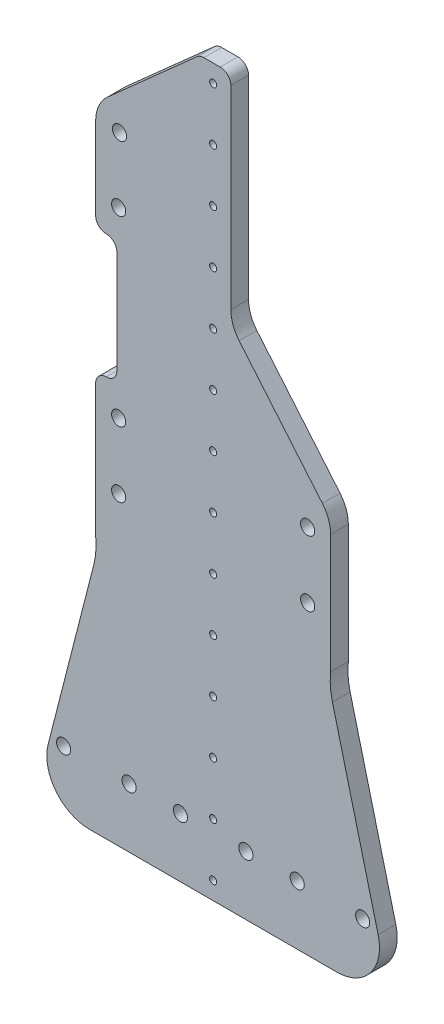
from build123d import *

# Parameters (mm, degrees)
SKETCH_1_R             = 2
EXTRUDE_1_DEPTH        = 5
SKETCH_2_R             = 1
CUT_EXTRUDE_1_DEPTH    = 20
PATTERN_LINEAR_1_COUNT = 14
PATTERN_LINEAR_1_PITCH = 15
FILLET_1_R             = 10
SKETCH_3_W             = 6
SKETCH_3_H             = 35
CUT_EXTRUDE_2_DEPTH    = 13
FILLET_2_R             = 3


with BuildPart() as part:
    # 草图1 → 凸台-拉伸1 (new body)
    # profile 1 of 4: a face of its own
    with BuildSketch(Plane.XY):
        with BuildLine():
            ThreePointArc((-33.2, -29.85450543), (-33.123455397, -33.472929676), (-33.700274419, -37.045902236))
            Line((-33.700274419, -37.045902236), (-46.624977248, -87.523440915))
            ThreePointArc((-46.624977248, -87.523440915), (-44.479417414, -97.858032719), (-35, -102.5))
            Line((-35, -102.5), (-5, -102.5))
            Line((-5, -102.5), (5, -102.5))
            Line((5, -102.5), (35, -102.5))
            ThreePointArc((35, -102.5), (44.479417414, -97.858032719), (46.624977248, -87.523440915))
            Line((46.624977248, -87.523440915), (33.700274419, -37.045902236))
            ThreePointArc((33.700274419, -37.045902236), (33.123455397, -33.472929676), (33.2, -29.85450543))
            Line((33.2, -29.85450543), (33.2, 7.364864087))
            Line((33.2, 7.364864087), (5, 41.001264624))
            Line((5, 41.001264624), (5, 99.5))
            ThreePointArc((5, 99.5), (4.121320344, 101.621320344), (2, 102.5))
            Line((2, 102.5), (-2.597497695, 102.5))
            ThreePointArc((-2.597497695, 102.5), (-3.665324968, 102.30352366), (-4.593283712, 101.739829943))
            Line((-4.593283712, 101.739829943), (-33.2, 76.25))
            Line((-33.2, 76.25), (-33.2, -29.85450543))
        make_face()
        with Locations((-42.25, -85.8)):
            Circle(SKETCH_1_R, mode=Mode.SUBTRACT)
        with Locations((-23.75, -85.8)):
            Circle(SKETCH_1_R, mode=Mode.SUBTRACT)
        with Locations((-9.25, -85.8)):
            Circle(SKETCH_1_R, mode=Mode.SUBTRACT)
        with Locations((-26.7, -16.25)):
            Circle(SKETCH_1_R, mode=Mode.SUBTRACT)
        with Locations((9.25, -85.8)):
            Circle(SKETCH_1_R, mode=Mode.SUBTRACT)
        with Locations((23.75, -85.8)):
            Circle(SKETCH_1_R, mode=Mode.SUBTRACT)
        with Locations((42.25, -85.8)):
            Circle(SKETCH_1_R, mode=Mode.SUBTRACT)
        with Locations((26.7, -16.25)):
            Circle(SKETCH_1_R, mode=Mode.SUBTRACT)
        with Locations((-26.7, 2.25)):
            Circle(SKETCH_1_R, mode=Mode.SUBTRACT)
        with Locations((-26.7, 53.751606034)):
            Circle(SKETCH_1_R, mode=Mode.SUBTRACT)
        with Locations((-26.45623641, 72.25)):
            Circle(SKETCH_1_R, mode=Mode.SUBTRACT)
        with Locations((26.7, 2.25)):
            Circle(SKETCH_1_R, mode=Mode.SUBTRACT)
    # profile 2 of 4: a face of its own
    with BuildSketch(Plane.XY):
        with BuildLine():
            ThreePointArc((-33.2, -29.85450543), (-33.123455397, -33.472929676), (-33.700274419, -37.045902236))
            Line((-33.700274419, -37.045902236), (-46.624977248, -87.523440915))
            ThreePointArc((-46.624977248, -87.523440915), (-44.479417414, -97.858032719), (-35, -102.5))
            Line((-35, -102.5), (-5, -102.5))
            Line((-5, -102.5), (5, -102.5))
            Line((5, -102.5), (35, -102.5))
            ThreePointArc((35, -102.5), (44.479417414, -97.858032719), (46.624977248, -87.523440915))
            Line((46.624977248, -87.523440915), (33.700274419, -37.045902236))
            ThreePointArc((33.700274419, -37.045902236), (33.123455397, -33.472929676), (33.2, -29.85450543))
            Line((33.2, -29.85450543), (33.2, 7.364864087))
            Line((33.2, 7.364864087), (5, 41.001264624))
            Line((5, 41.001264624), (5, 99.5))
            ThreePointArc((5, 99.5), (4.121320344, 101.621320344), (2, 102.5))
            Line((2, 102.5), (-2.597497695, 102.5))
            ThreePointArc((-2.597497695, 102.5), (-3.665324968, 102.30352366), (-4.593283712, 101.739829943))
            Line((-4.593283712, 101.739829943), (-33.2, 76.25))
            Line((-33.2, 76.25), (-33.2, -29.85450543))
        make_face()
        with Locations((-42.25, -85.8)):
            Circle(SKETCH_1_R, mode=Mode.SUBTRACT)
        with Locations((-23.75, -85.8)):
            Circle(SKETCH_1_R, mode=Mode.SUBTRACT)
        with Locations((-9.25, -85.8)):
            Circle(SKETCH_1_R, mode=Mode.SUBTRACT)
        with Locations((-26.7, -16.25)):
            Circle(SKETCH_1_R, mode=Mode.SUBTRACT)
        with Locations((9.25, -85.8)):
            Circle(SKETCH_1_R, mode=Mode.SUBTRACT)
        with Locations((23.75, -85.8)):
            Circle(SKETCH_1_R, mode=Mode.SUBTRACT)
        with Locations((42.25, -85.8)):
            Circle(SKETCH_1_R, mode=Mode.SUBTRACT)
        with Locations((26.7, -16.25)):
            Circle(SKETCH_1_R, mode=Mode.SUBTRACT)
        with Locations((-26.7, 2.25)):
            Circle(SKETCH_1_R, mode=Mode.SUBTRACT)
        with Locations((-26.7, 53.751606034)):
            Circle(SKETCH_1_R, mode=Mode.SUBTRACT)
        with Locations((-26.45623641, 72.25)):
            Circle(SKETCH_1_R, mode=Mode.SUBTRACT)
        with Locations((26.7, 2.25)):
            Circle(SKETCH_1_R, mode=Mode.SUBTRACT)
    # profile 3 of 4: a face of its own
    with BuildSketch(Plane.XY):
        with BuildLine():
            ThreePointArc((-33.2, -29.85450543), (-33.123455397, -33.472929676), (-33.700274419, -37.045902236))
            Line((-33.700274419, -37.045902236), (-46.624977248, -87.523440915))
            ThreePointArc((-46.624977248, -87.523440915), (-44.479417414, -97.858032719), (-35, -102.5))
            Line((-35, -102.5), (-5, -102.5))
            Line((-5, -102.5), (5, -102.5))
            Line((5, -102.5), (35, -102.5))
            ThreePointArc((35, -102.5), (44.479417414, -97.858032719), (46.624977248, -87.523440915))
            Line((46.624977248, -87.523440915), (33.700274419, -37.045902236))
            ThreePointArc((33.700274419, -37.045902236), (33.123455397, -33.472929676), (33.2, -29.85450543))
            Line((33.2, -29.85450543), (33.2, 7.364864087))
            Line((33.2, 7.364864087), (5, 41.001264624))
            Line((5, 41.001264624), (5, 99.5))
            ThreePointArc((5, 99.5), (4.121320344, 101.621320344), (2, 102.5))
            Line((2, 102.5), (-2.597497695, 102.5))
            ThreePointArc((-2.597497695, 102.5), (-3.665324968, 102.30352366), (-4.593283712, 101.739829943))
            Line((-4.593283712, 101.739829943), (-33.2, 76.25))
            Line((-33.2, 76.25), (-33.2, -29.85450543))
        make_face()
        with Locations((-42.25, -85.8)):
            Circle(SKETCH_1_R, mode=Mode.SUBTRACT)
        with Locations((-23.75, -85.8)):
            Circle(SKETCH_1_R, mode=Mode.SUBTRACT)
        with Locations((-9.25, -85.8)):
            Circle(SKETCH_1_R, mode=Mode.SUBTRACT)
        with Locations((-26.7, -16.25)):
            Circle(SKETCH_1_R, mode=Mode.SUBTRACT)
        with Locations((9.25, -85.8)):
            Circle(SKETCH_1_R, mode=Mode.SUBTRACT)
        with Locations((23.75, -85.8)):
            Circle(SKETCH_1_R, mode=Mode.SUBTRACT)
        with Locations((42.25, -85.8)):
            Circle(SKETCH_1_R, mode=Mode.SUBTRACT)
        with Locations((26.7, -16.25)):
            Circle(SKETCH_1_R, mode=Mode.SUBTRACT)
        with Locations((-26.7, 2.25)):
            Circle(SKETCH_1_R, mode=Mode.SUBTRACT)
        with Locations((-26.7, 53.751606034)):
            Circle(SKETCH_1_R, mode=Mode.SUBTRACT)
        with Locations((-26.45623641, 72.25)):
            Circle(SKETCH_1_R, mode=Mode.SUBTRACT)
        with Locations((26.7, 2.25)):
            Circle(SKETCH_1_R, mode=Mode.SUBTRACT)
    # profile 4 of 4: a face of its own
    with BuildSketch(Plane.XY):
        with BuildLine():
            ThreePointArc((-33.2, -29.85450543), (-33.123455397, -33.472929676), (-33.700274419, -37.045902236))
            Line((-33.700274419, -37.045902236), (-46.624977248, -87.523440915))
            ThreePointArc((-46.624977248, -87.523440915), (-44.479417414, -97.858032719), (-35, -102.5))
            Line((-35, -102.5), (-5, -102.5))
            Line((-5, -102.5), (5, -102.5))
            Line((5, -102.5), (35, -102.5))
            ThreePointArc((35, -102.5), (44.479417414, -97.858032719), (46.624977248, -87.523440915))
            Line((46.624977248, -87.523440915), (33.700274419, -37.045902236))
            ThreePointArc((33.700274419, -37.045902236), (33.123455397, -33.472929676), (33.2, -29.85450543))
            Line((33.2, -29.85450543), (33.2, 7.364864087))
            Line((33.2, 7.364864087), (5, 41.001264624))
            Line((5, 41.001264624), (5, 99.5))
            ThreePointArc((5, 99.5), (4.121320344, 101.621320344), (2, 102.5))
            Line((2, 102.5), (-2.597497695, 102.5))
            ThreePointArc((-2.597497695, 102.5), (-3.665324968, 102.30352366), (-4.593283712, 101.739829943))
            Line((-4.593283712, 101.739829943), (-33.2, 76.25))
            Line((-33.2, 76.25), (-33.2, -29.85450543))
        make_face()
        with Locations((-42.25, -85.8)):
            Circle(SKETCH_1_R, mode=Mode.SUBTRACT)
        with Locations((-23.75, -85.8)):
            Circle(SKETCH_1_R, mode=Mode.SUBTRACT)
        with Locations((-9.25, -85.8)):
            Circle(SKETCH_1_R, mode=Mode.SUBTRACT)
        with Locations((-26.7, -16.25)):
            Circle(SKETCH_1_R, mode=Mode.SUBTRACT)
        with Locations((9.25, -85.8)):
            Circle(SKETCH_1_R, mode=Mode.SUBTRACT)
        with Locations((23.75, -85.8)):
            Circle(SKETCH_1_R, mode=Mode.SUBTRACT)
        with Locations((42.25, -85.8)):
            Circle(SKETCH_1_R, mode=Mode.SUBTRACT)
        with Locations((26.7, -16.25)):
            Circle(SKETCH_1_R, mode=Mode.SUBTRACT)
        with Locations((-26.7, 2.25)):
            Circle(SKETCH_1_R, mode=Mode.SUBTRACT)
        with Locations((-26.7, 53.751606034)):
            Circle(SKETCH_1_R, mode=Mode.SUBTRACT)
        with Locations((-26.45623641, 72.25)):
            Circle(SKETCH_1_R, mode=Mode.SUBTRACT)
        with Locations((26.7, 2.25)):
            Circle(SKETCH_1_R, mode=Mode.SUBTRACT)
    extrude(amount=EXTRUDE_1_DEPTH)

    # 草图2 → 切除-拉伸1 (cut)
    with BuildSketch(Plane.XY):
        with Locations((0, 97.5)):
            Circle(SKETCH_2_R)
    cut_extrude_1 = extrude(amount=CUT_EXTRUDE_1_DEPTH, mode=Mode.SUBTRACT)

    # 阵列(线性)1: 切除-拉伸1 ×14
    with Locations(*[(0, -i * PATTERN_LINEAR_1_PITCH, 0) for i in range(1, PATTERN_LINEAR_1_COUNT)]):
        add(cut_extrude_1, mode=Mode.SUBTRACT)

    # 圆角1
    fillet_1_edges = [part.edges().sort_by_distance(p)[0] for p in [
        (-33.2, 76.25, 2.5),
        (5, 41.001264624, 2.5),
        (33.2, 7.364864087, 2.5),
    ]]
    fillet(fillet_1_edges, radius=FILLET_1_R)

    # 草图3 → 切除-拉伸2 (cut)
    with BuildSketch(Plane.XY):
        with Locations((-30.2, 28.069279085)):
            Rectangle(SKETCH_3_W, SKETCH_3_H)
    extrude(amount=CUT_EXTRUDE_2_DEPTH, mode=Mode.SUBTRACT)

    # 圆角2
    fillet_2_edges = [part.edges().sort_by_distance(p)[0] for p in [
        (-27.2, 45.569279085, 2.5),
        (-27.2, 10.569279085, 2.5),
    ]]
    fillet(fillet_2_edges, radius=FILLET_2_R)
    fillet_2_2_edges = [part.edges().sort_by_distance(p)[0] for p in [
        (-33.2, 45.569279085, 2.5),
        (-33.2, 10.569279085, 2.5),
    ]]
    fillet(fillet_2_2_edges, radius=FILLET_2_R - 0.0001)  # a hair under: the kernel refuses the full size


solid = part.part
